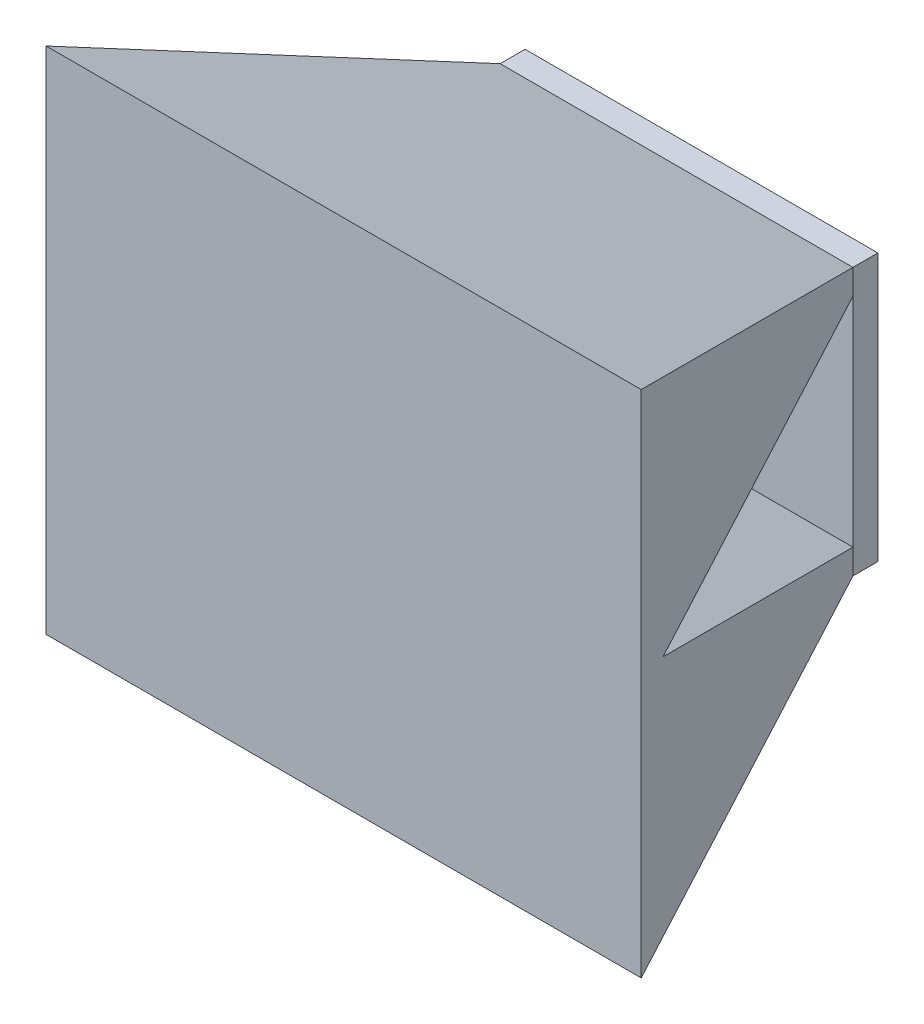
from build123d import *
from build123d.topology import SkipClean

# Parameters (mm, degrees)
SKETCH1_W           = 42.4
SKETCH1_H           = 32.12
BOSS_EXTRUDE1_DEPTH = 3
SKETCH2_W           = 42.4
SKETCH2_H           = 3
SKETCH2_W_2         = 3
SKETCH2_H_2         = 32.12
BOSS_EXTRUDE2_DEPTH = 40
BOSS_EXTRUDE2_TAPER = -20


with BuildPart() as part:
    # Sketch1 → Boss-Extrude1 (new body)
    with BuildSketch(Plane.XY):
        Rectangle(SKETCH1_W, SKETCH1_H)
    extrude(amount=BOSS_EXTRUDE1_DEPTH)

    # Sketch2 → Boss-Extrude2 (add)
    with SkipClean():  # the faces are left unmerged after this step: merging them gives an invalid solid
        with BuildSketch(Plane.XY.offset(3)):
            with Locations((0, 14.56)):
                Rectangle(SKETCH2_W, SKETCH2_H)
            with Locations((0, -14.56)):
                Rectangle(SKETCH2_W, SKETCH2_H)
            Rectangle(SKETCH2_W_2, SKETCH2_H_2)
        extrude(amount=BOSS_EXTRUDE2_DEPTH, taper=BOSS_EXTRUDE2_TAPER)
    add(part.part.scale(1), mode=Mode.REPLACE)  # the faces are merged on a copy


solid = part.part
